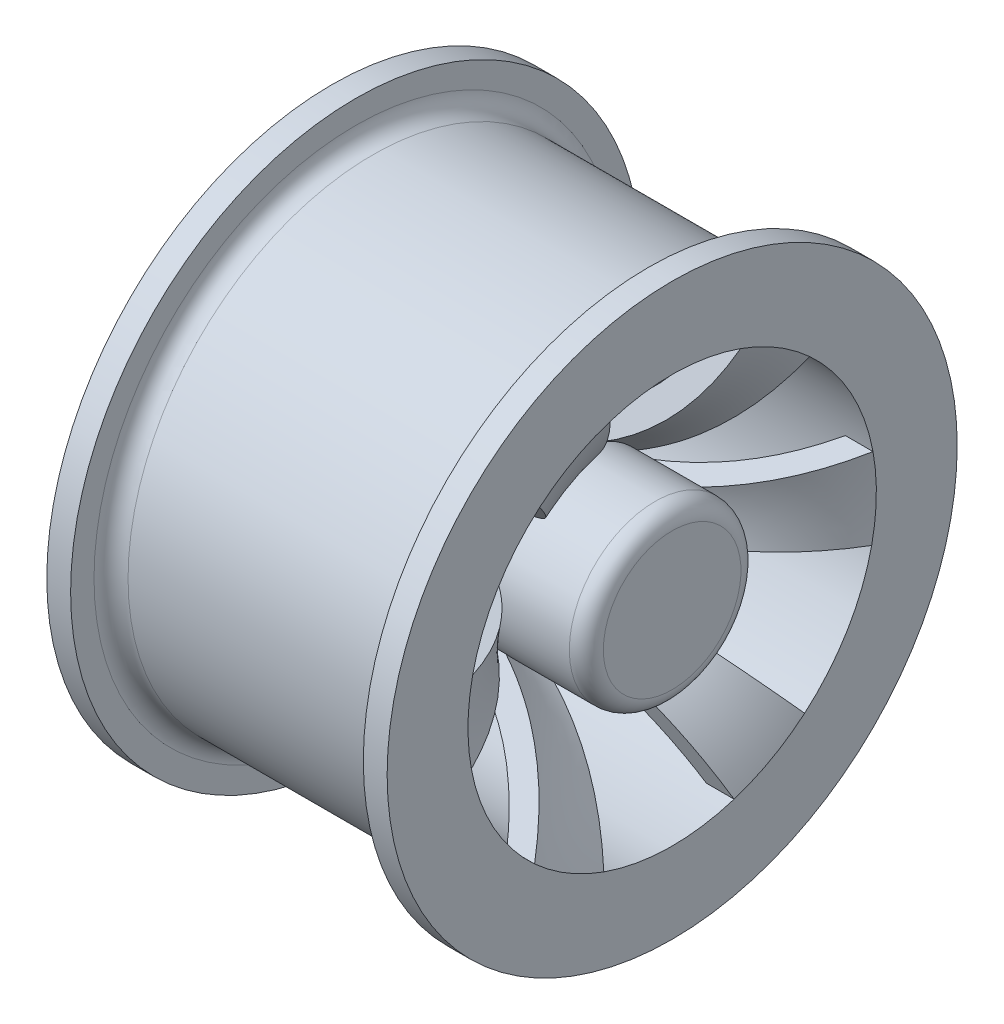
from build123d import *
from build123d.topology import SkipClean

# Parameters (mm, degrees)
SKETCH2_R           = 12.812507943
SKETCH2_R_2         = 8.89
BOSS_EXTRUDE1_DEPTH = 50.8
SKETCH3_R           = 12.812507943
BOSS_EXTRUDE2_DEPTH = 10.16
CUT_EXTRUDE1_DEPTH  = 79.745120801
CIRPATTERN1_COUNT   = 6
FILLET1_R           = 2.54


# Read off the part's stored shape, not the designer's step: Revolve1
with BuildPart() as part:
    # Revolve1 outline → Revolve1 (revolve)
    with BuildSketch(Plane.YX):
        with BuildLine():
            Line((8.89, 0), (12.812507943, 0))
            add(Edge.make_bspline(
                [(30.48, 21.267937651), (30.309023597, 21.192105008), (29.508904573, 20.830209988), (27.54071299, 19.853128917), (24.775190006, 18.16464464), (21.854472712, 15.840046365), (19.302035246, 13.206553615), (17.10058625, 10.247215331), (15.23937391, 6.941426723), (13.969670275, 3.872573278), (13.216678126, 1.508927527), (12.91724489, 0.408653288), (12.812507943, 0)],
                knots=[0.045662691, 0.045662691, 0.045662691, 0.045662691, 0.0625, 0.125, 0.25, 0.375, 0.5, 0.625, 0.75, 0.875, 0.9375, 0.974110002, 0.974110002, 0.974110002, 0.974110002], degree=3))
            Line((30.48, 21.267937651), (30.48, -25.4))
            Line((30.48, -25.4), (42.545, -25.4))
            Line((42.545, -25.4), (42.545, -21.844))
            Line((42.545, -21.844), (39.0525, -21.844))
            ThreePointArc((39.0525, -21.844), (37.256448776, -21.100051224), (36.5125, -19.304))
            Line((36.5125, -19.304), (36.5125, 19.304))
            ThreePointArc((36.5125, 19.304), (37.256448776, 21.100051224), (39.0525, 21.844))
            Line((39.0525, 21.844), (42.545, 21.844))
            Line((42.545, 21.844), (42.545, 25.4))
            Line((42.545, 25.4), (30.48, 25.4))
            add(Edge.make_bspline(
                [(30.48, 25.4), (13.230283967, 18.539405633), (8.89, 0)],
                knots=[0.751440896, 0.751440896, 0.751440896, 1.751440896, 1.751440896, 1.751440896], degree=2))
        make_face()
    revolve(axis=Axis((0, 0, 0), (1, 0, 0)))



with BuildPart() as body_2:
    # Sketch2 → Boss-Extrude1 (new body)
    with BuildSketch(Plane.ZY.offset(25.4)):
        Circle(SKETCH2_R)
        Circle(SKETCH2_R_2, mode=Mode.SUBTRACT)
    extrude(amount=-BOSS_EXTRUDE1_DEPTH)


with BuildPart() as part_1:
    add(part.part)

    add(body_2.part)  # Boss-Extrude2 merges body 2
    # Sketch3 → Boss-Extrude2 (add)
    with BuildSketch(Plane(origin=(25.4, 0, 0), x_dir=(0, 0, -1), z_dir=(1, 0, 0))):
        with Locations(Location((0, 0, 0), (0, 0, 180))):
            Circle(SKETCH3_R)
    extrude(amount=-BOSS_EXTRUDE2_DEPTH)

    # Sketch4 → Cut-Extrude1 (cut, through all)
    with BuildSketch(Plane(origin=(25.4, 0, 0), x_dir=(0, 0, -1), z_dir=(1, 0, 0))):
        with BuildLine():
            Line((-9.243384813, 29.044624928), (-2.296598789, 12.604998762))
            ThreePointArc((-2.296598789, 12.604998762), (1.031106032, 12.770950636), (4.289083469, 12.07328136))
            Line((4.289083469, 12.07328136), (10.203409411, 28.721435138))
            ThreePointArc((10.203409411, 28.721435138), (0.506482692, 30.475791627), (-9.243384813, 29.044624928))
        make_face()
    cut_extrude1 = extrude(amount=-CUT_EXTRUDE1_DEPTH, mode=Mode.SUBTRACT)

    # CirPattern1: Cut-Extrude1 ×6 about axis
    with SkipClean():  # the faces are left unmerged after this step: merging them gives an invalid solid
        cirpattern1_axis = Axis((0, 0, 0), (1, 0, 0))
        for i in range(1, CIRPATTERN1_COUNT):
            add(cut_extrude1.rotate(cirpattern1_axis, i * 360 / CIRPATTERN1_COUNT), mode=Mode.SUBTRACT)

    # Fillet1
    fillet1_edges = [part_1.edges().sort_by_distance(p)[0] for p in [
        (25.4, 12.027308376, 4.416357439),
    ]]
    fillet(fillet1_edges, radius=FILLET1_R)


solid = part_1.part
